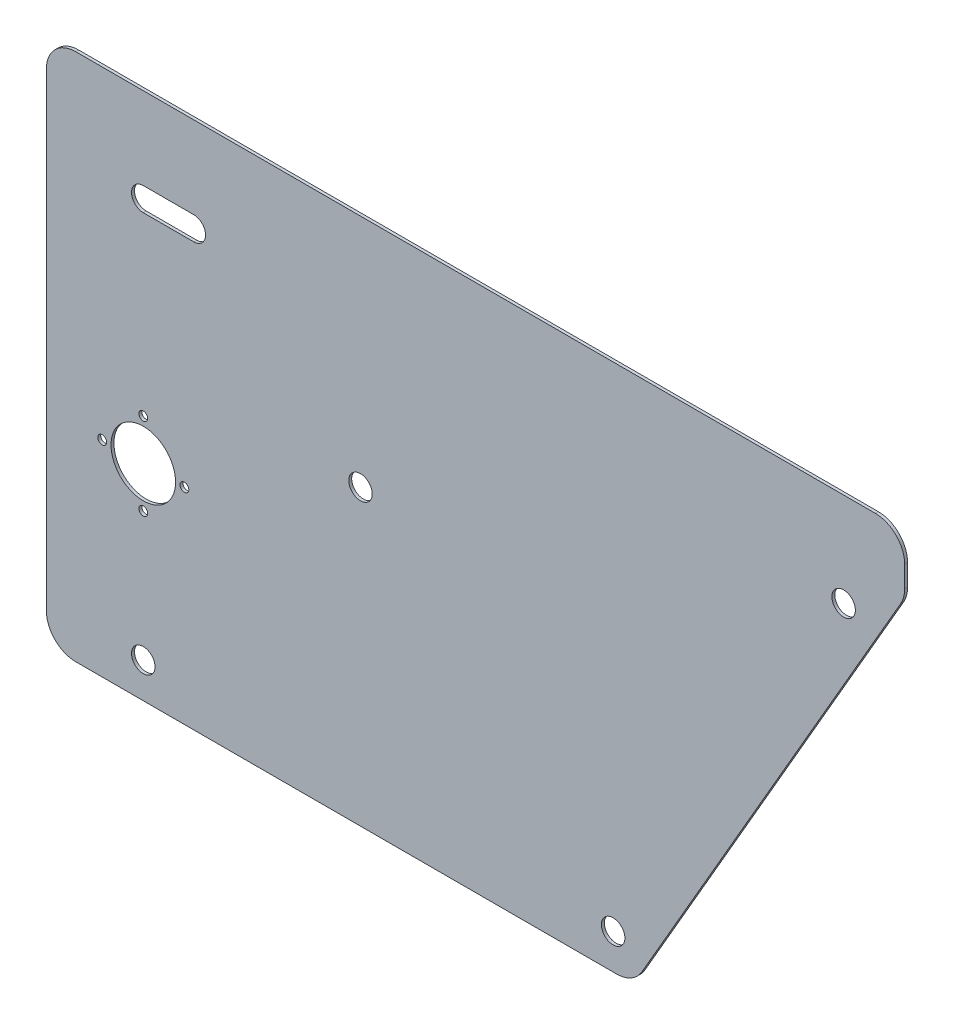
from build123d import *

# Parameters (mm, degrees)
BOSS_EXTRUDE1_DEPTH = 1
FILLET1_R           = 10
SKETCH2_R           = 4
SKETCH2_R_2         = 11
SKETCH2_R_3         = 1.5
CUT_EXTRUDE1_DEPTH  = 3


with BuildPart() as part:
    # Sketch1 → Boss-Extrude1 (new body)
    with BuildSketch(Plane.XY):
        Polygon((-100, 100), (-100, -80), (100, -80), (192.37604307, 80), (192.37604307, 100), align=None)
    extrude(amount=BOSS_EXTRUDE1_DEPTH)

    # Fillet1
    fillet1_edges = [part.edges().sort_by_distance(p)[0] for p in [
        (100, -80, 0.5),
        (-100, -80, 0.5),
        (192.37604307, 100, 0.5),
        (-100, 100, 0.5),
        (192.37604307, 80, 0.5),
    ]]
    fillet(fillet1_edges, radius=FILLET1_R)

    # Sketch2 → Cut-Extrude1 (cut)
    with BuildSketch(Plane.XY.offset(1)):
        with Locations((93.07179677, -68)):
            Circle(SKETCH2_R)
        with Locations((171.59143338, 68)):
            Circle(SKETCH2_R)
        with Locations((-67, -10)):
            Circle(SKETCH2_R_2)
        with Locations((-67, -68)):
            Circle(SKETCH2_R)
        with Locations((-53, -10)):
            Circle(SKETCH2_R_3)
        with Locations((-67, 4)):
            Circle(SKETCH2_R_3)
        with Locations((-81, -10)):
            Circle(SKETCH2_R_3)
        with Locations((-67, -24)):
            Circle(SKETCH2_R_3)
        with Locations((6.998807119, 20)):
            Circle(SKETCH2_R)
        with BuildLine():
            Line((-67, 72), (-49.783746602, 72))
            ThreePointArc((-49.783746602, 72), (-45.783746602, 68), (-49.783746602, 64))
            Line((-49.783746602, 64), (-67, 64))
            ThreePointArc((-67, 64), (-71, 68), (-67, 72))
        make_face()
    extrude(amount=-CUT_EXTRUDE1_DEPTH, mode=Mode.SUBTRACT)


solid = part.part
